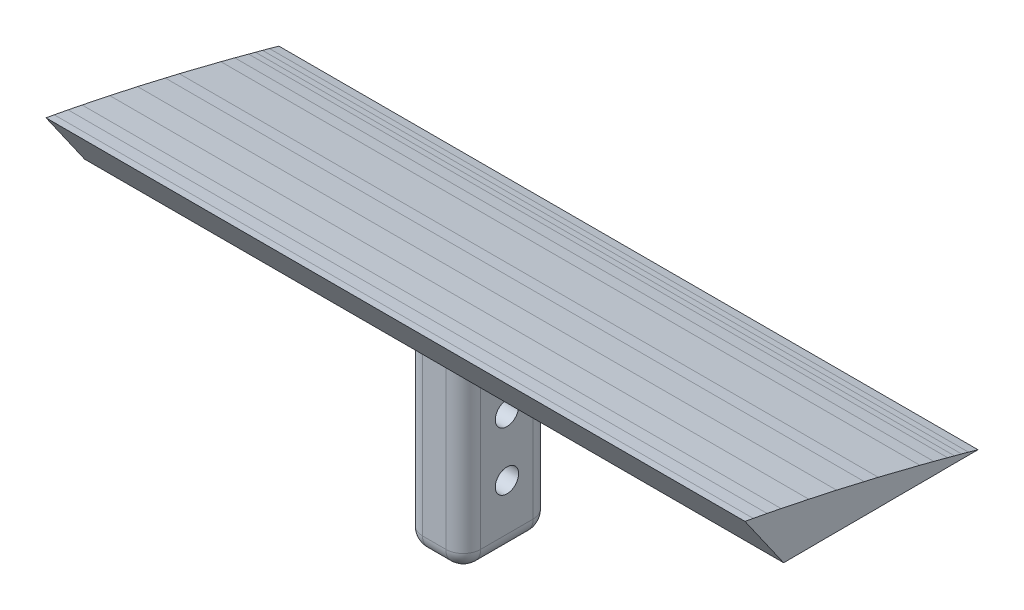
from build123d import *

# Parameters (mm, degrees)
BOSS_EXTRUDE1_DEPTH             = 60
BOSS_EXTRUDE2_REACH             = 90.732
BOSS_EXTRUDE2_DIRECTION_2_DEPTH = 15
FILLET1_R                       = 1.5
CUT_EXTRUDE1_REACH              = 75.969
SKETCH6_R                       = 0.9999999999999981
SKETCH6_R_2                     = 0.9999999999999983


with BuildPart() as part:
    # Sketch4 → Boss-Extrude1 (new body)
    with BuildSketch(Plane(origin=(0, 0, 0), x_dir=(0, 0, -1), z_dir=(1, 0, 0))):
        Polygon((65.19977734950682, 2.249999999999957), (64.37324575864596, 2.486572833307158), (63.78296406534201, 2.6455304457371853), (63.18268238763812, 2.8044703948171197), (62.59240069433575, 2.9634280072521335), (61.40183732332823, 3.2813255687674197), (60.21129161567675, 3.5892231458822574), (59.020763571381124, 3.8871207385967033), (57.83023552708528, 4.185018331311205), (56.63970748278934, 4.482915924025726), (55.439214780803276, 4.760795884584427), (54.248722063219084, 5.038693508498167), (53.05822934563407, 5.316591132412104), (51.86777195475985, 5.574488787525479), (50.677314563885815, 5.832386442638817), (49.486874836366844, 6.080284113351947), (48.296435108848044, 6.32818178406504), (47.09601306028438, 6.5660618070224395), (45.905608659476414, 6.793959508934967), (45.19977734950682, 6.923160403528422), (48.51497929806861, 2.1885613487423403), (49.35374610001776, 2.1900428946664965), (50.55374422805156, 2.192162497315831), (51.753724692729946, 2.2042820843654467), (52.953722820763744, 2.20640168701478), (54.15372094879753, 2.2085212896641138), (55.363719061231606, 2.210658555668859), (56.5637171892654, 2.212778158318192), (57.763697653943794, 2.224897745367808), (58.96369578197758, 2.227017348017141), (60.163693910011375, 2.229136950666475), (61.36369203804516, 2.231256553315808), (62.56367250272354, 2.2433761403654233), (63.16367156674045, 2.24443594169009), (63.76367063075733, 2.245495743014757), (64.36366969477423, 2.246555544339424), (64.96366875879261, 2.247615345663863), align=None)
    extrude(amount=BOSS_EXTRUDE1_DEPTH)

    # Sketch5 → Boss-Extrude2 (add, up to next)
    with BuildSketch(Plane(origin=(0, 2.1885613487423403, 0), x_dir=(1, 0, 0), z_dir=(0, 1, 0)), mode=Mode.PRIVATE) as boss_extrude2_sk1:
        Polygon((27.5, 48.51497929806862), (32.5, 48.51497929806862), (32.5, 56.01497929806862), (27.499999999999996, 56.01497929806862), align=None)
    boss_extrude2_tool1 = extrude(boss_extrude2_sk1.sketch, amount=BOSS_EXTRUDE2_REACH, mode=Mode.PRIVATE) - part.part
    add(boss_extrude2_tool1.solids().sort_by_distance((30, 2.188561, -52.264979))[0])

    # Sketch5 → Boss-Extrude2 direction 2 (add)
    with BuildSketch(Plane(origin=(0, 2.1885613487423403, 0), x_dir=(1, 0, 0), z_dir=(0, 1, 0))):
        Polygon((27.5, 48.51497929806862), (32.5, 48.51497929806862), (32.5, 56.01497929806862), (27.499999999999996, 56.01497929806862), align=None)
    extrude(amount=-BOSS_EXTRUDE2_DIRECTION_2_DEPTH)

    # Fillet1
    fillet1_edges = [part.edges().sort_by_distance(p)[0] for p in [
        (27.499999999999996, -5.299814874845729, -56.01497929806862),
        (30, -12.81143865125766, -56.01497929806862),
        (27.5, -12.81143865125766, -52.26497929806862),
        (27.5, -5.31143865125766, -48.51497929806862),
        (30, -12.81143865125766, -48.51497929806862),
        (32.5, -5.29981487484573, -56.01497929806862),
        (32.5, -5.31143865125766, -48.51497929806862),
        (32.5, -12.81143865125766, -52.26497929806862),
    ]]
    fillet(fillet1_edges, radius=FILLET1_R)

    # Sketch6 → Cut-Extrude1 (cut, up to next)
    with BuildSketch(Plane.ZY.offset(-27.50000000000002), mode=Mode.PRIVATE) as cut_extrude1_sk1:
        with Locations((-52.2649792980686, -7.311438651257659)):
            Circle(SKETCH6_R)
    cut_extrude1_tool1 = extrude(cut_extrude1_sk1.sketch, amount=-CUT_EXTRUDE1_REACH, mode=Mode.PRIVATE) & part.part
    # Sketch6 → Cut-Extrude1 (cut, up to next)
    with BuildSketch(Plane.ZY.offset(-27.50000000000002), mode=Mode.PRIVATE) as cut_extrude1_sk2:
        with Locations((-52.2649792980686, -2.311438651257659)):
            Circle(SKETCH6_R_2)
    cut_extrude1_tool2 = extrude(cut_extrude1_sk2.sketch, amount=-CUT_EXTRUDE1_REACH, mode=Mode.PRIVATE) & part.part
    add(cut_extrude1_tool1.solids().sort_by_distance((27.5, -7.311439, -52.264979))[0], mode=Mode.SUBTRACT)
    add(cut_extrude1_tool2.solids().sort_by_distance((27.5, -2.311439, -52.264979))[0], mode=Mode.SUBTRACT)


solid = part.part
